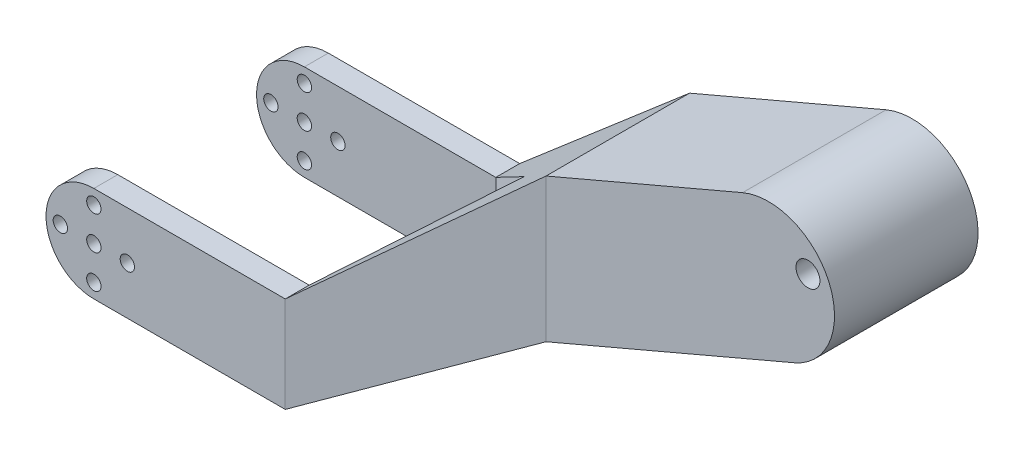
from build123d import *

# Parameters (mm, degrees)
SKETCH1_R           = 1.5
BOSS_EXTRUDE1_DEPTH = 5
SKETCH2_R           = 1.5
BOSS_EXTRUDE2_DEPTH = 5
SPLIT6_START        = -34.5
SPLIT6_DEPTH        = 30
SKETCH24_R          = 2.5
CUT_EXTRUDE3_DEPTH  = 149.21791213


# Read off the part's stored shape, not the designer's step: Split6
with BuildPart() as part:
    # Sketch1 → Boss-Extrude1 (new body)
    with BuildSketch(Plane.XY):
        with BuildLine():
            Line((-20, 10), (20, 10))
            Line((20, 10), (20, -10))
            Line((20, -10), (-20, -10))
            ThreePointArc((-20, -10), (-30, 0), (-20, 10))
        make_face()
        with Locations((-20, 0)):
            Circle(SKETCH1_R, mode=Mode.SUBTRACT)
        with Locations((-20, -7)):
            Circle(SKETCH1_R, mode=Mode.SUBTRACT)
        with Locations((-27, 0)):
            Circle(SKETCH1_R, mode=Mode.SUBTRACT)
        with Locations((-20, 7)):
            Circle(SKETCH1_R, mode=Mode.SUBTRACT)
        with Locations((-13, 0)):
            Circle(SKETCH1_R, mode=Mode.SUBTRACT)
    extrude(amount=BOSS_EXTRUDE1_DEPTH)



with BuildPart() as body_2:
    # Sketch2 → Boss-Extrude2 (new body)
    with BuildSketch(Plane(origin=(0, 0, -39), x_dir=(-1, 0, 0), z_dir=(0, 0, -1))):
        with BuildLine():
            Line((-20, 10), (20, 10))
            ThreePointArc((20, 10), (30, 0), (20, -10))
            Line((20, -10), (-20, -10))
            Line((-20, -10), (-20, 10))
        make_face()
        with Locations(Location((20, 0, 0), (0, 0, 180))):
            Circle(SKETCH2_R, mode=Mode.SUBTRACT)
        with Locations(Location((13, 0, 0), (0, 0, 180))):
            Circle(SKETCH2_R, mode=Mode.SUBTRACT)
        with Locations(Location((20, 7, 0), (0, 0, 180))):
            Circle(SKETCH2_R, mode=Mode.SUBTRACT)
        with Locations(Location((27, 0, 0), (0, 0, 180))):
            Circle(SKETCH2_R, mode=Mode.SUBTRACT)
        with Locations(Location((20, -7, 0), (0, 0, 180))):
            Circle(SKETCH2_R, mode=Mode.SUBTRACT)
    extrude(amount=BOSS_EXTRUDE2_DEPTH)

    # Sketch12 → section 1 of loft1
    with BuildSketch(Plane(origin=(65, 0, 0), x_dir=(0, 0, -1), z_dir=(1, 0, 0)), mode=Mode.PRIVATE) as loft1_s1:
        with BuildLine():
            Line((4.5, 50), (34.5, 50))
            Line((34.5, 50), (34.5, 20))
            Line((34.5, 20), (4.5, 20))
            Line((4.5, 20), (4.5, 50))
        make_face()
    # loft from a face of the part (loft1)
    loft([body_2.faces().sort_by_distance((20, 0, -41.5))[0], loft1_s1.sketch])


with BuildPart() as part_1:
    add(part.part)

    add(body_2.part)  # loft2 joins it to this body
    # loft from a face of the part (loft2)
    loft([part_1.faces().sort_by_distance((20, 0, 2.5))[0], part_1.faces().sort_by_distance((65, 35, -19.5))[0]])

    # Sketch18 → section 1 of loft3
    with BuildSketch(Plane(origin=(140, 0, 0), x_dir=(0, 0, -1), z_dir=(1, 0, 0)), mode=Mode.PRIVATE) as loft3_s1:
        with BuildLine():
            Line((4.5, 82), (34.5, 82))
            Line((34.5, 82), (34.5, 52))
            Line((34.5, 52), (4.5, 52))
            Line((4.5, 52), (4.5, 82))
        make_face()
    # loft from a face of the part (loft3)
    loft([part_1.faces().sort_by_distance((65, 35, -19.5))[0], loft3_s1.sketch])

    # Split6 outline → Split6 (cut)
    with BuildSketch(Plane.XY.offset(SPLIT6_START)):
        with BuildLine():
            ThreePointArc((106.079345998, 67.527187626), (124.183572198, 60.251657472), (116.908042043, 42.147431272))
            Line((116.908042043, 42.147431272), (140, 52))
            Line((140, 52), (140, 82))
            Line((140, 82), (106.079345998, 67.527187626))
        make_face()
    extrude(amount=SPLIT6_DEPTH, mode=Mode.SUBTRACT)

    # Sketch24 → Cut-Extrude3 (cut, through all)
    with BuildSketch(Plane.XY.offset(-4.5)):
        with Locations((119.739276472, 59.632240301)):
            Circle(SKETCH24_R)
    extrude(amount=-CUT_EXTRUDE3_DEPTH, mode=Mode.SUBTRACT)


solid = part_1.part
